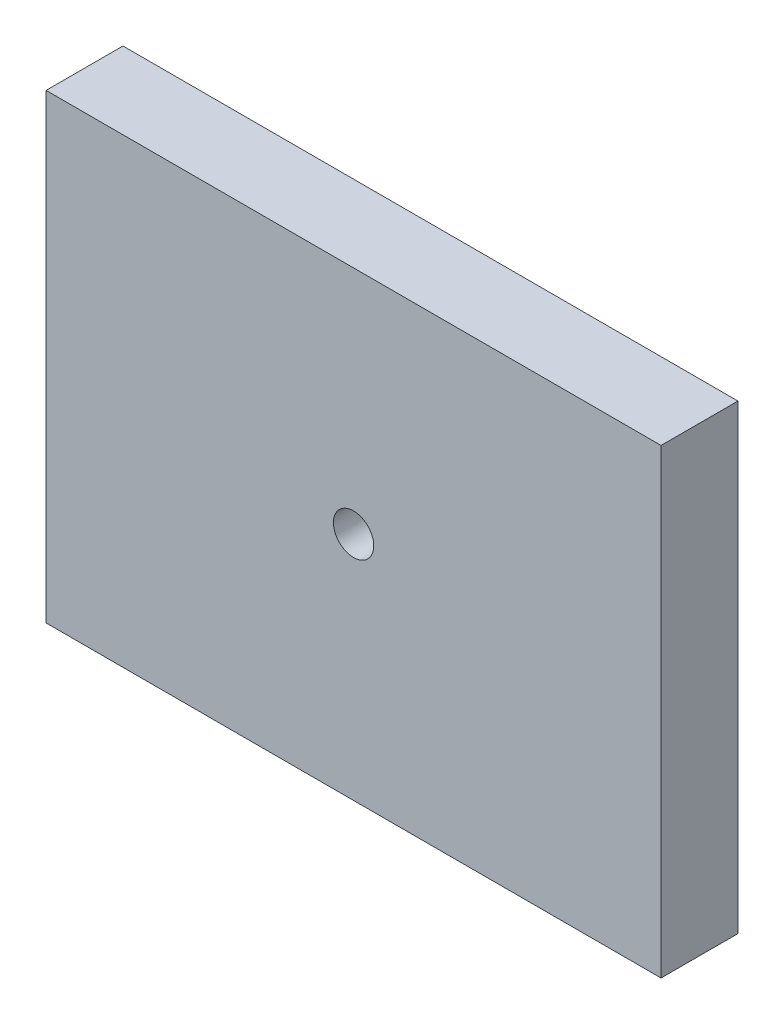
from build123d import *

# Parameters (mm, degrees)
ESQUISSE1_W             = 101.6
ESQUISSE1_H             = 76.2
BOSS_EXTRU_1_DEPTH      = 12.7
ESQUISSE2_R             = 3.33375
ENL_V_MAT_EXTRU_1_DEPTH = 65.757547823


with BuildPart() as part:
    # Esquisse1 → Boss.-Extru.1 (new body)
    with BuildSketch(Plane.XY):
        Rectangle(ESQUISSE1_W, ESQUISSE1_H)
    extrude(amount=BOSS_EXTRU_1_DEPTH)

    # Esquisse2 → Enlèv. mat.-Extru.1 (cut, through all)
    with BuildSketch(Plane(origin=(0, 0, 0), x_dir=(-1, 0, 0), z_dir=(0, 0, -1))):
        Circle(ESQUISSE2_R)
    extrude(amount=-ENL_V_MAT_EXTRU_1_DEPTH, mode=Mode.SUBTRACT)


solid = part.part
